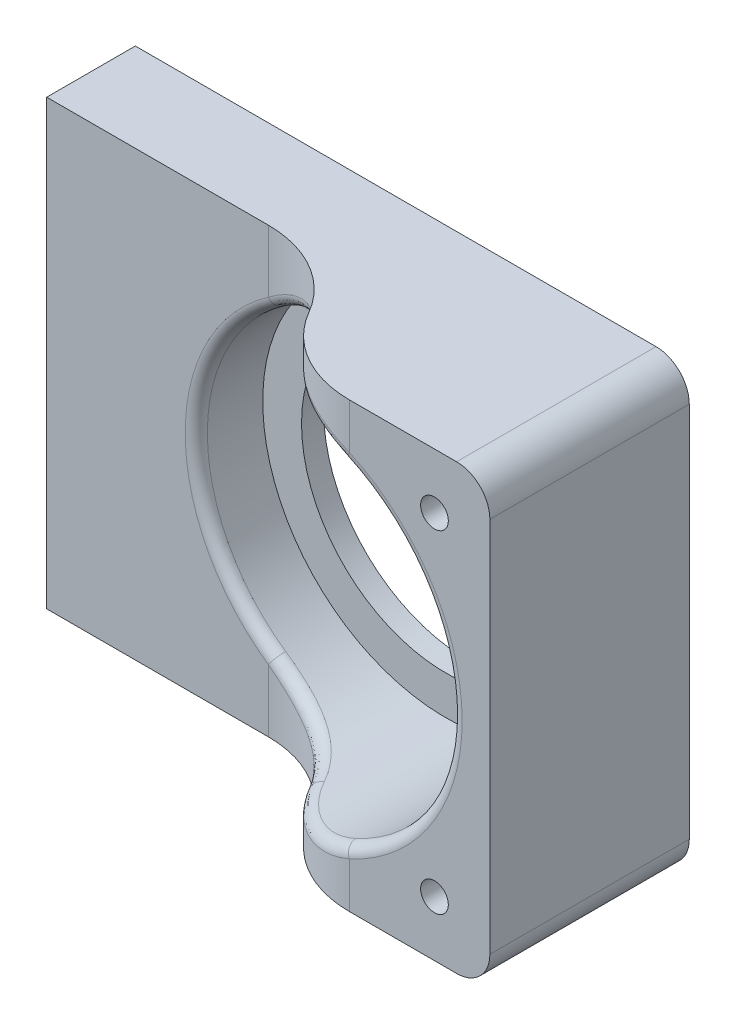
from build123d import *

# Parameters (mm, degrees)
SKETCH_1_W          = 50
SKETCH_1_H          = 40
EXTRUDE_1_DEPTH     = 8
SKETCH_2_W          = 20
SKETCH_2_H          = 40
EXTRUDE_2_DEPTH     = 10
SKETCH_3_R          = 16.5
CUT_EXTRUDE_1_DEPTH = 16
SKETCH_5_R          = 1.25
CUT_EXTRUDE_2_DEPTH = 37.728735344
SKETCH_6_R          = 1.25
CUT_EXTRUDE_3_DEPTH = 10
FILLET_1_R          = 10
FILLET_2_R          = 10
FILLET_3_R          = 3
SKETCH_7_R          = 13
CUT_EXTRUDE_4_DEPTH = 36.791060507
FILLET_4_R          = 1


with BuildPart() as part:
    # 草图1 → 凸台-拉伸1 (new body)
    with BuildSketch(Plane.XY):
        Rectangle(SKETCH_1_W, SKETCH_1_H)
    extrude(amount=EXTRUDE_1_DEPTH)

    # 草图2 → 凸台-拉伸2 (add)
    with BuildSketch(Plane.XY.offset(8)):
        with Locations((15, 0)):
            Rectangle(SKETCH_2_W, SKETCH_2_H)
    extrude(amount=EXTRUDE_2_DEPTH)

    # 草图3 → 切除-拉伸1 (cut)
    with BuildSketch(Plane.XY.offset(18)):
        with Locations((5, 0)):
            Circle(SKETCH_3_R)
    extrude(amount=-CUT_EXTRUDE_1_DEPTH, mode=Mode.SUBTRACT)

    # 草图5 → 切除-拉伸2 (cut, through all)
    with BuildSketch(Plane.XY.offset(18)):
        with Locations((20, 15)):
            Circle(SKETCH_5_R)
        with Locations(Location((20, -15, 0), (0, 0, 180))):
            Circle(SKETCH_5_R)
    extrude(amount=-CUT_EXTRUDE_2_DEPTH, mode=Mode.SUBTRACT)

    # 草图6 → 切除-拉伸3 (cut)
    with BuildSketch(Plane.ZY.offset(25)):
        with Locations((4, 15)):
            Circle(SKETCH_6_R)
        with Locations(Location((4, -15, 0), (0, 0, 180))):
            Circle(SKETCH_6_R)
    extrude(amount=-CUT_EXTRUDE_3_DEPTH, mode=Mode.SUBTRACT)

    # 圆角1
    fillet_1_edges = [part.edges().sort_by_distance(p)[0] for p in [
        (5, -18.25, 8),
        (5, 18.25, 8),
    ]]
    fillet(fillet_1_edges, radius=FILLET_1_R - 0.0001)  # a hair under: the kernel refuses the full size

    # 圆角2
    fillet_2_edges = [part.edges().sort_by_distance(p)[0] for p in [
        (5, -18.25, 18),
        (5, 18.25, 18),
    ]]
    fillet(fillet_2_edges, radius=FILLET_2_R)

    # 圆角3
    fillet_3_edges = [part.edges().sort_by_distance(p)[0] for p in [
        (25, -20, 9),
        (25, 20, 9),
    ]]
    fillet(fillet_3_edges, radius=FILLET_3_R)

    # 草图7 → 切除-拉伸4 (cut, through all)
    with BuildSketch(Plane.XY.offset(2)):
        with Locations((5, 0)):
            Circle(SKETCH_7_R)
    extrude(amount=-CUT_EXTRUDE_4_DEPTH, mode=Mode.SUBTRACT)

    # 圆角4
    fillet_4_edges = [part.edges().sort_by_distance(p)[0] for p in [
        (-11.5, 0, 8),
        (-0.245631372, -15.643955751, 9.202461182),
        (19.018542731, -8.702324959, 18),
        (-0.245631372, 15.643955751, 9.202461182),
        (7.42567519, 16.320726083, 16.720103053),
        (7.42567519, -16.320726083, 16.720103053),
    ]]
    fillet(fillet_4_edges, radius=FILLET_4_R)


solid = part.part
